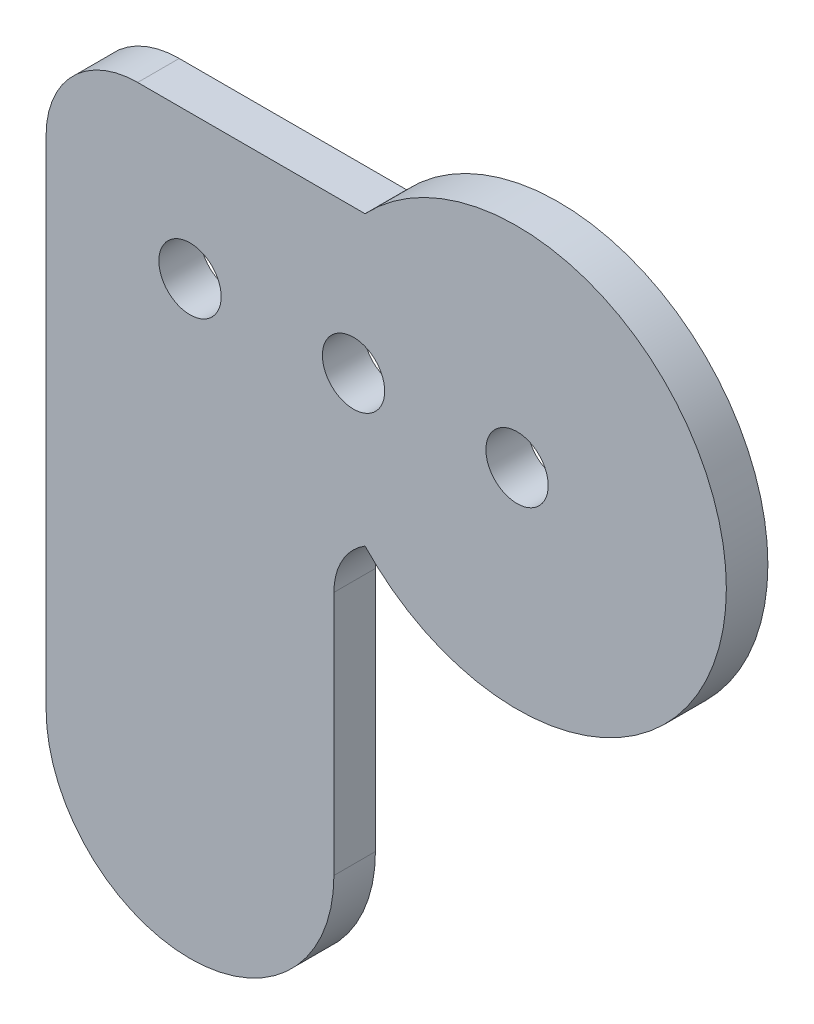
from build123d import *

# Parameters (mm, degrees)
BOSS_EXTRUDE1_DEPTH = 3.175
FILLET1_R           = 7
FILLET2_R           = 5
SKETCH2_R           = 2.38125
CUT_EXTRUDE1_DEPTH  = 58.715514595
LPATTERN1_COUNT     = 3
LPATTERN1_PITCH     = 12.5


with BuildPart() as part:
    # Sketch1 → Boss-Extrude1 (new body)
    with BuildSketch(Plane.XY):
        with BuildLine():
            Line((-11.618950039, 11), (-36, 11))
            Line((-36, 11), (-36, -34))
            ThreePointArc((-36, -34), (-25, -45), (-14, -34))
            Line((-14, -34), (-14, -11))
            Line((-14, -11), (-11.618950039, -11))
            ThreePointArc((-11.618950039, -11), (16, 0), (-11.618950039, 11))
        make_face()
    extrude(amount=BOSS_EXTRUDE1_DEPTH)

    # Fillet1
    fillet1_edges = [part.edges().sort_by_distance(p)[0] for p in [
        (-36, 11, 1.5875),
    ]]
    fillet(fillet1_edges, radius=FILLET1_R)

    # Fillet2
    # the kernel refuses this fillet: 5 mm, written as the material it adds along each edge
    with BuildSketch(Plane(origin=(-14, -11, 0), x_dir=(1, 0, 0), z_dir=(0, 0, 1))) as fillet2_piece_1:
        with BuildLine():
            CenterArc((5, -4.259237102), FILLET2_R, 121.586822832, 58.413177168)
            Line((0, -4.259237102), (-0.1, -4.259237102))
            Line((-0.1, -4.259237102), (-0.1, 0))
            Line((-0.1, 0), (0, 0.1))
            ThreePointArc((0, 0.1), (1.190524981, 0.1), (2.328670961, 0.085184742))
            Line((2.328670961, 0.085184742), (2.381049961, 0))
        make_face()
    extrude(amount=3.175)

    # Sketch2 → Cut-Extrude1 (cut, through all)
    with BuildSketch(Plane.XY.offset(3.175)):
        Circle(SKETCH2_R)
    cut_extrude1 = extrude(amount=-CUT_EXTRUDE1_DEPTH, mode=Mode.SUBTRACT)

    # LPattern1: Cut-Extrude1 ×3
    with Locations(*[(-i * LPATTERN1_PITCH, 0, 0) for i in range(1, LPATTERN1_COUNT)]):
        add(cut_extrude1, mode=Mode.SUBTRACT)


solid = part.part
